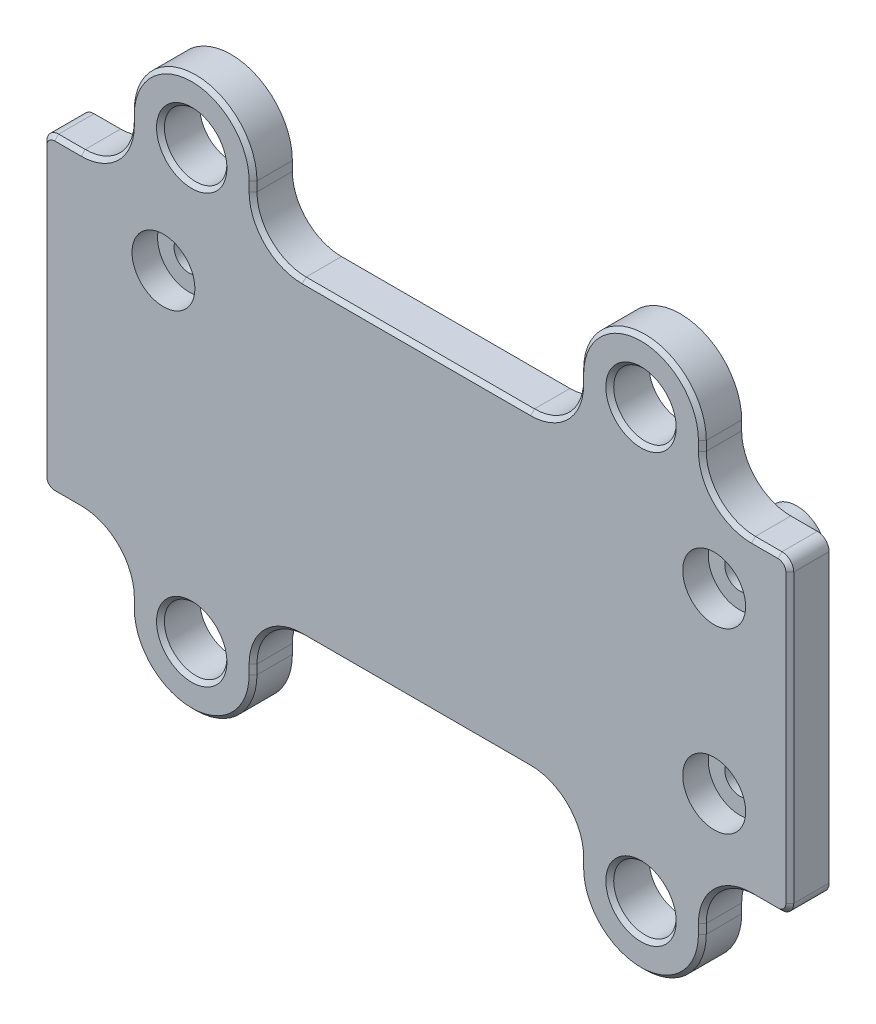
from build123d import *
from build123d.topology import SkipClean

# Parameters (mm, degrees)
SKETCH1_W               = 48.26
SKETCH1_H               = 35.56
BOSS_EXTRUDE1_DEPTH     = 4.445
SKETCH2_OUTSIDE_W       = 62.282
SKETCH2_OUTSIDE_H       = 49.582
CUT_EXTRUDE2_DEPTH      = 61.110724709
SKETCH3_R               = 2.0193
CUT_EXTRUDE3_DEPTH      = 61.110724709
CHAMFER1_SIZE           = 0.254
SKETCH4_OUTSIDE_W       = 62.282
SKETCH4_OUTSIDE_H       = 49.582
SKETCH4_OUTSIDE_W_2     = 12.446
SKETCH4_OUTSIDE_H_2     = 1.524
CUT_EXTRUDE4_DEPTH      = 1.905
SKETCH16_W              = 12.446
SKETCH16_H              = 1.524
BOSS_EXTRUDE12_DEPTH    = 1.27
CUT_EXTRUDE5_DEPTH      = 1.016
BOSS_EXTRUDE2_DEPTH     = 1.016
CUT_EXTRUDE6_DEPTH      = 48.4925664
CUT_EXTRUDE6_DEPTH_BACK = 48.4925664
F_3DSKETCH1_R           = 0.9652
F_3DSKETCH1_R_2         = 0.5715
SKETCH7_R               = 0.5715
CUT_EXTRUDE7_DEPTH      = 2.54
SKETCH9_W               = 4.902032443
SKETCH9_H               = 4.572
SKETCH9_R               = 0.9652
SKETCH9_W_2             = 6.35
SKETCH9_H_2             = 4.497155915
SKETCH9_H_3             = 4.013032443
BOSS_EXTRUDE8_DEPTH     = 1.016
SKETCH8_R               = 2.032
CUT_EXTRUDE8_DEPTH      = 1.651
CHAMFER4_SIZE           = 0.127
FILLET1_R               = 3.175
SKETCH11_R              = 1.9558
SKETCH11_R_2            = 0.9652
BOSS_EXTRUDE9_DEPTH     = 2.794
FILLET2_R               = 2.54
FILLET3_R               = 0.7874
BOSS_EXTRUDE10_DEPTH    = 1.016
BOSS_EXTRUDE11_DEPTH    = 1.016
FILLET4_START           = 1.905
FILLET4_DEPTH           = 2.095
CHAMFER6_DEPTH          = 1.905
DRAFT1_ANGLE            = 3


with BuildPart() as part:
    # Sketch1 → Boss-Extrude1 (new body)
    with BuildSketch(Plane.XY):
        with Locations((24.13, 17.78)):
            Rectangle(SKETCH1_W, SKETCH1_H)
    extrude(amount=BOSS_EXTRUDE1_DEPTH)

    # Sketch2 outside → Cut-Extrude2 (cut, through all)
    with BuildSketch(Plane.XY.offset(4.445)):
        with Locations((24.13, 17.78)):
            Rectangle(SKETCH2_OUTSIDE_W, SKETCH2_OUTSIDE_H)
        with BuildLine():
            Line((0.762, 7.747), (2.4765, 7.747))
            ThreePointArc((2.4765, 7.747), (4.72156403, 6.81706403), (5.6515, 4.572))
            Line((5.6515, 4.572), (5.6515, 3.9624))
            ThreePointArc((5.6515, 3.9624), (9.6139, 0), (13.5763, 3.9624))
            Line((13.5763, 3.9624), (13.5763, 4.572))
            ThreePointArc((13.5763, 4.572), (14.50623597, 6.81706403), (16.7513, 7.747))
            Line((16.7513, 7.747), (31.5087, 7.747))
            ThreePointArc((31.5087, 7.747), (33.75376403, 6.81706403), (34.6837, 4.572))
            Line((34.6837, 4.572), (34.6837, 3.9624))
            ThreePointArc((34.6837, 3.9624), (38.6461, 0), (42.6085, 3.9624))
            Line((42.6085, 3.9624), (42.6085, 4.572))
            ThreePointArc((42.6085, 4.572), (43.53843597, 6.81706403), (45.7835, 7.747))
            Line((45.7835, 7.747), (47.498, 7.747))
            ThreePointArc((47.498, 7.747), (48.036815367, 7.970184633), (48.26, 8.509))
            Line((48.26, 8.509), (48.26, 27.051))
            ThreePointArc((48.26, 27.051), (48.036815367, 27.589815367), (47.498, 27.813))
            Line((47.498, 27.813), (45.7835, 27.813))
            ThreePointArc((45.7835, 27.813), (43.53843597, 28.74293597), (42.6085, 30.988))
            Line((42.6085, 30.988), (42.6085, 31.5976))
            ThreePointArc((42.6085, 31.5976), (38.6461, 35.56), (34.6837, 31.5976))
            Line((34.6837, 31.5976), (34.6837, 30.988))
            ThreePointArc((34.6837, 30.988), (33.75376403, 28.74293597), (31.5087, 27.813))
            Line((31.5087, 27.813), (16.7513, 27.813))
            ThreePointArc((16.7513, 27.813), (14.50623597, 28.74293597), (13.5763, 30.988))
            Line((13.5763, 30.988), (13.5763, 31.5976))
            ThreePointArc((13.5763, 31.5976), (9.6139, 35.56), (5.6515, 31.5976))
            Line((5.6515, 31.5976), (5.6515, 30.988))
            ThreePointArc((5.6515, 30.988), (4.72156403, 28.74293597), (2.4765, 27.813))
            Line((2.4765, 27.813), (0.762, 27.813))
            ThreePointArc((0.762, 27.813), (0.223184633, 27.589815367), (0, 27.051))
            Line((0, 27.051), (0, 8.509))
            ThreePointArc((0, 8.509), (0.223184633, 7.970184633), (0.762, 7.747))
        make_face(mode=Mode.SUBTRACT)
    extrude(amount=-CUT_EXTRUDE2_DEPTH, mode=Mode.SUBTRACT)

    # Sketch3 → Cut-Extrude3 (cut, through all)
    with BuildSketch(Plane.XY.offset(4.445)):
        with Locations((9.6139, 31.5976)):
            Circle(SKETCH3_R)
        with Locations((38.6461, 31.5976)):
            Circle(SKETCH3_R)
        with Locations((38.6461, 3.9624)):
            Circle(SKETCH3_R)
        with Locations((9.6139, 3.9624)):
            Circle(SKETCH3_R)
    extrude(amount=-CUT_EXTRUDE3_DEPTH, mode=Mode.SUBTRACT)

    # Chamfer1
    chamfer1_edges = [part.edges().sort_by_distance(p)[0] for p in [
        (7.5946, 31.5976, 4.445),
        (36.6268, 31.5976, 4.445),
        (36.6268, 3.9624, 4.445),
        (7.5946, 3.9624, 4.445),
        (0, 17.78, 4.445),
        (48.26, 17.78, 4.445),
        (9.6139, 35.56, 4.445),
        (38.6461, 35.56, 4.445),
        (38.6461, 0, 4.445),
        (9.6139, 0, 4.445),
        (4.72156403, 6.81706403, 4.445),
        (1.61925, 7.747, 4.445),
        (0.223184633, 7.970184633, 4.445),
        (0.223184633, 27.589815367, 4.445),
        (1.61925, 27.813, 4.445),
        (4.72156403, 28.74293597, 4.445),
        (5.6515, 31.2928, 4.445),
        (13.5763, 31.2928, 4.445),
        (14.50623597, 28.74293597, 4.445),
        (24.13, 27.813, 4.445),
        (33.75376403, 28.74293597, 4.445),
        (34.6837, 31.2928, 4.445),
        (42.6085, 31.2928, 4.445),
        (43.53843597, 28.74293597, 4.445),
        (46.64075, 27.813, 4.445),
        (48.036815367, 27.589815367, 4.445),
        (48.036815367, 7.970184633, 4.445),
        (46.64075, 7.747, 4.445),
        (43.53843597, 6.81706403, 4.445),
        (42.6085, 4.2672, 4.445),
        (34.6837, 4.2672, 4.445),
        (33.75376403, 6.81706403, 4.445),
        (24.13, 7.747, 4.445),
        (14.50623597, 6.81706403, 4.445),
        (13.5763, 4.2672, 4.445),
        (5.6515, 4.2672, 4.445),
    ]]
    chamfer(chamfer1_edges, length=CHAMFER1_SIZE)

    # Sketch4 outside → Cut-Extrude4 (cut)
    with BuildSketch(Plane(origin=(0, 0, 0), x_dir=(-1, 0, 0), z_dir=(0, 0, -1))):
        with Locations((-24.13, 17.78)):
            Rectangle(SKETCH4_OUTSIDE_W, SKETCH4_OUTSIDE_H)
        with Locations((-22.225, 8.509)):
            Rectangle(SKETCH4_OUTSIDE_W_2, SKETCH4_OUTSIDE_H_2, mode=Mode.SUBTRACT)
    extrude(amount=-CUT_EXTRUDE4_DEPTH, mode=Mode.SUBTRACT)

    # Sketch16 → Boss-Extrude12 (add)
    with BuildSketch(Plane(origin=(0, 0, 0), x_dir=(-1, 0, 0), z_dir=(0, 0, -1))):
        with Locations((-22.225, 8.509)):
            Rectangle(SKETCH16_W, SKETCH16_H)
    extrude(amount=BOSS_EXTRUDE12_DEPTH)

    # Sketch5 → Cut-Extrude5 (cut)
    with BuildSketch(Plane(origin=(0, 0, 1.905), x_dir=(-1, 0, 0), z_dir=(0, 0, -1))):
        with BuildLine():
            Line((-44.6278, 10.414), (-3.6322, 10.414))
            ThreePointArc((-3.6322, 10.414), (-3.039503096, 10.659503096), (-2.794, 11.2522))
            Line((-2.794, 11.2522), (-2.794, 24.3078))
            ThreePointArc((-2.794, 24.3078), (-3.039503096, 24.900496904), (-3.6322, 25.146))
            Line((-3.6322, 25.146), (-44.6278, 25.146))
            ThreePointArc((-44.6278, 25.146), (-45.220496904, 24.900496904), (-45.466, 24.3078))
            Line((-45.466, 24.3078), (-45.466, 11.2522))
            ThreePointArc((-45.466, 11.2522), (-45.220496904, 10.659503096), (-44.6278, 10.414))
        make_face()
    extrude(amount=-CUT_EXTRUDE5_DEPTH, mode=Mode.SUBTRACT)

    # Sketch6 → Boss-Extrude2 (add)
    with BuildSketch(Plane(origin=(0, 0, 1.905), x_dir=(-1, 0, 0), z_dir=(0, 0, -1))):
        with BuildLine():
            Line((-2.54, 9.2075), (-6.553032443, 9.2075))
            Line((-6.553032443, 9.2075), (-6.807032443, 9.4615))
            Line((-6.807032443, 9.4615), (-6.807032443, 10.16))
            Line((-6.807032443, 10.16), (-6.553032443, 10.414))
            Line((-6.553032443, 10.414), (-3.632032443, 10.414))
            ThreePointArc((-3.632032443, 10.414), (-3.03945402, 10.65945402), (-2.794, 11.252032443))
            Line((-2.794, 11.252032443), (-2.794, 14.173032443))
            Line((-2.794, 14.173032443), (-2.54, 14.427032443))
            Line((-2.54, 14.427032443), (-1.905, 14.427032443))
            Line((-1.905, 14.427032443), (-1.651, 14.173032443))
            Line((-1.651, 14.173032443), (-1.651, 10.0965))
            ThreePointArc((-1.651, 10.0965), (-1.911382072, 9.467882072), (-2.54, 9.2075))
        make_face()
        with BuildLine():
            Line((-2.54, 26.3525), (-6.8072, 26.3525))
            Line((-6.8072, 26.3525), (-6.8072, 26.2255))
            Line((-6.8072, 26.2255), (-6.8072, 25.273))
            Line((-6.8072, 25.273), (-6.8072, 25.146))
            Line((-6.8072, 25.146), (-3.632032443, 25.146))
            ThreePointArc((-3.632032443, 25.146), (-3.03945402, 24.90054598), (-2.794, 24.307967557))
            Line((-2.794, 24.307967557), (-2.794, 21.386967557))
            Line((-2.794, 21.386967557), (-2.54, 21.132967557))
            Line((-2.54, 21.132967557), (-1.905, 21.132967557))
            Line((-1.905, 21.132967557), (-1.651, 21.386967557))
            Line((-1.651, 21.386967557), (-1.651, 25.4635))
            ThreePointArc((-1.651, 25.4635), (-1.911382072, 26.092117928), (-2.54, 26.3525))
        make_face()
        with BuildLine():
            Line((-46.609, 10.0965), (-46.609, 14.301381018))
            Line((-46.609, 14.301381018), (-46.609, 14.427032443))
            Line((-46.609, 14.427032443), (-45.593, 14.427032443))
            Line((-45.593, 14.427032443), (-45.466, 14.427032443))
            Line((-45.466, 14.427032443), (-45.466, 11.252032443))
            ThreePointArc((-45.466, 11.252032443), (-45.22054598, 10.65945402), (-44.627967557, 10.414))
            Line((-44.627967557, 10.414), (-40.563967557, 10.414))
            Line((-40.563967557, 10.414), (-40.563967557, 10.287))
            Line((-40.563967557, 10.287), (-40.563967557, 9.3345))
            Line((-40.563967557, 9.3345), (-40.563967557, 9.2075))
            Line((-40.563967557, 9.2075), (-45.72, 9.2075))
            ThreePointArc((-45.72, 9.2075), (-46.348617928, 9.467882072), (-46.609, 10.0965))
        make_face()
        with BuildLine():
            Line((-45.593, 21.132967557), (-46.609, 21.132967557))
            Line((-46.609, 21.132967557), (-46.609, 21.2598))
            Line((-46.609, 21.2598), (-46.609, 25.4635))
            ThreePointArc((-46.609, 25.4635), (-46.348617928, 26.092117928), (-45.72, 26.3525))
            Line((-45.72, 26.3525), (-40.563967557, 26.3525))
            Line((-40.563967557, 26.3525), (-40.563967557, 26.2255))
            Line((-40.563967557, 26.2255), (-40.563967557, 25.273))
            Line((-40.563967557, 25.273), (-40.563967557, 25.146))
            Line((-40.563967557, 25.146), (-44.627967557, 25.146))
            ThreePointArc((-44.627967557, 25.146), (-45.22054598, 24.90054598), (-45.466, 24.307967557))
            Line((-45.466, 24.307967557), (-45.466, 21.132967557))
            Line((-45.466, 21.132967557), (-45.593, 21.132967557))
        make_face()
        Polygon((-26.5176, 26.0985), (-26.2636, 26.3525), (-21.9964, 26.3525), (-21.7424, 26.0985), (-21.7424, 25.4), (-21.9964, 25.146), (-26.2636, 25.146), (-26.5176, 25.4), align=None)
    extrude(amount=BOSS_EXTRUDE2_DEPTH)

    # 3DSketch1 → Cut-Extrude6 (cut, two sides: drawn at the far end of the back side and taken through both)
    # profile 1 of 3: a face of its own
    with BuildSketch(Plane(origin=(7.786455915, 23.823844085, -2.6162), x_dir=(0.9516958120786183, -0.3070424747034511, 0), z_dir=(0, 0, 1)).offset(-CUT_EXTRUDE6_DEPTH_BACK)):
        with Locations(Location((33.866476151, 10.926229279, 0), (0, 0, 17.88108636))):
            Circle(F_3DSKETCH1_R)
        with Locations(Location((33.866476151, 10.926229279, 0), (0, 0, 17.88108636))):
            Circle(F_3DSKETCH1_R_2, mode=Mode.SUBTRACT)
    # profile 2 of 3: a face of its own
    with BuildSketch(Plane(origin=(7.786455915, 23.823844085, -2.6162), x_dir=(0.9516958120786183, -0.3070424747034511, 0), z_dir=(0, 0, 1)).offset(-CUT_EXTRUDE6_DEPTH_BACK)):
        with Locations(Location((37.391569395, 0, 0), (0, 0, 17.88108636))):
            Circle(F_3DSKETCH1_R)
        with Locations(Location((37.391569395, 0, 0), (0, 0, 17.88108636))):
            Circle(F_3DSKETCH1_R_2, mode=Mode.SUBTRACT)
    # profile 3 of 3: a face of its own
    with BuildSketch(Plane(origin=(7.786455915, 23.823844085, -2.6162), x_dir=(0.9516958120786183, -0.3070424747034511, 0), z_dir=(0, 0, 1)).offset(-CUT_EXTRUDE6_DEPTH_BACK)):
        with Locations(Location((0, 0, 0), (0, 0, 17.88108636))):
            Circle(F_3DSKETCH1_R)
        with Locations(Location((0, 0, 0), (0, 0, 17.88108636))):
            Circle(F_3DSKETCH1_R_2, mode=Mode.SUBTRACT)
    extrude(amount=CUT_EXTRUDE6_DEPTH + CUT_EXTRUDE6_DEPTH_BACK, mode=Mode.SUBTRACT)


with BuildPart() as cut_extrude6_piece_1:
    # of the separate pieces the step leaves, piece 1, a body of its own (cut_extrude6_pieces)
    add(part.part.solids().sort_by_distance((5.6515, 3.9624, 4.191))[0])

    # Sketch9 → Boss-Extrude8 (add)
    # profile 1 of 3: a face of its own
    with BuildSketch(Plane(origin=(0, 0, 2.921), x_dir=(-1, 0, 0), z_dir=(0, 0, -1))):
        with Locations((-43.014983779, 12.7)):
            Rectangle(SKETCH9_W, SKETCH9_H)
        with Locations(Location((-43.371855915, 12.343044085, 0), (0, 0, 180))):
            Circle(SKETCH9_R, mode=Mode.SUBTRACT)
    # profile 2 of 3: a face of its own
    with BuildSketch(Plane(origin=(0, 0, 2.921), x_dir=(-1, 0, 0), z_dir=(0, 0, -1))):
        with Locations((-7.786455915, 22.897422043)):
            Rectangle(SKETCH9_W_2, SKETCH9_H_2)
        with Locations(Location((-7.786455915, 23.823844085, 0), (0, 0, 180))):
            Circle(SKETCH9_R, mode=Mode.SUBTRACT)
    # profile 3 of 3: a face of its own
    with BuildSketch(Plane(origin=(0, 0, 2.921), x_dir=(-1, 0, 0), z_dir=(0, 0, -1))):
        with Locations((-43.014983779, 23.139483779)):
            Rectangle(SKETCH9_W, SKETCH9_H_3)
        with Locations(Location((-43.371855915, 23.823844085, 0), (0, 0, 180))):
            Circle(SKETCH9_R, mode=Mode.SUBTRACT)
    extrude(amount=BOSS_EXTRUDE8_DEPTH)

    # Sketch8 → Cut-Extrude8 (cut)
    with BuildSketch(Plane.XY.offset(4.445)):
        with Locations((7.786455915, 23.823844085)):
            Circle(SKETCH8_R)
        with Locations((43.371855915, 23.823844085)):
            Circle(SKETCH8_R)
        with Locations((43.371855915, 12.343044085)):
            Circle(SKETCH8_R)
    extrude(amount=-CUT_EXTRUDE8_DEPTH, mode=Mode.SUBTRACT)

    # Chamfer4
    chamfer4_edges = [cut_extrude6_piece_1.edges().sort_by_distance(p)[0] for p in [
        (24.13, 26.3525, 0.889),
        (26.3906, 26.2255, 0.889),
        (26.5176, 25.74925, 0.889),
        (26.3906, 25.273, 0.889),
        (24.13, 25.146, 0.889),
        (21.8694, 25.273, 0.889),
        (21.7424, 25.74925, 0.889),
        (21.8694, 26.2255, 0.889),
    ]]
    chamfer(chamfer4_edges, length=CHAMFER4_SIZE)

    # Fillet1
    fillet1_edges = [cut_extrude6_piece_1.edges().sort_by_distance(p)[0] for p in [
        (10.961455915, 20.648844085, 2.413),
        (4.611455915, 20.648844085, 2.413),
    ]]
    fillet(fillet1_edges, radius=FILLET1_R - 0.0001)  # a hair under: the kernel refuses the full size

    # Sketch11 → Boss-Extrude9 (add)
    # profile 1 of 3: a face of its own
    with BuildSketch(Plane(origin=(0, 0, 1.905), x_dir=(-1, 0, 0), z_dir=(0, 0, -1))):
        with Locations(Location((-43.371855915, 23.823844085, 0), (0, 0, 138.510032486))):
            Circle(SKETCH11_R)
        with Locations(Location((-43.371855915, 23.823844085, 0), (0, 0, 180))):
            Circle(SKETCH11_R_2, mode=Mode.SUBTRACT)
    # profile 2 of 3: a face of its own
    with BuildSketch(Plane(origin=(0, 0, 1.905), x_dir=(-1, 0, 0), z_dir=(0, 0, -1))):
        with Locations(Location((-43.371855915, 12.343044085, 0), (0, 0, 260.511847353))):
            Circle(SKETCH11_R)
        with Locations(Location((-43.371855915, 12.343044085, 0), (0, 0, 180))):
            Circle(SKETCH11_R_2, mode=Mode.SUBTRACT)
    # profile 3 of 3: a face of its own
    with BuildSketch(Plane(origin=(0, 0, 1.905), x_dir=(-1, 0, 0), z_dir=(0, 0, -1))):
        with Locations(Location((-7.786455915, 23.823844085, 0), (0, 0, 59.954122435))):
            Circle(SKETCH11_R)
        with Locations(Location((-7.786455915, 23.823844085, 0), (0, 0, 180))):
            Circle(SKETCH11_R_2, mode=Mode.SUBTRACT)
    extrude(amount=BOSS_EXTRUDE9_DEPTH)

    # Fillet2
    fillet2_edges = [cut_extrude6_piece_1.edges().sort_by_distance(p)[0] for p in [
        (40.563967557, 21.132967557, 2.413),
        (40.563967557, 14.986, 2.413),
    ]]
    fillet(fillet2_edges, radius=FILLET2_R)

    # Fillet3
    # the kernel refuses this fillet: 0.7874 mm, written as the material it adds along each edge
    with BuildSketch(Plane(origin=(41.930655936, 25.146, 0.889), x_dir=(-1, 0, 0), z_dir=(0, 0, 1))) as fillet3_piece_1:
        with BuildLine():
            CenterArc((1.249372889, 0.7874), FILLET3_R, 168.758855809, 101.241144191)
            Line((0.477078825, 0.940894753), (0.461632944, 0.943964648))
            ThreePointArc((0.461632944, 0.943964648), (0.289129693, 0.444795675), (-0.011604467, 0.010645931))
            Line((-0.011604467, 0.010645931), (0, -0.015748))
            Line((0, -0.015748), (1.249372889, -0.015748))
            Line((1.249372889, -0.015748), (1.249372889, 0))
        make_face()
    extrude(amount=1.016)
    with BuildSketch(Plane(origin=(43.049454679, 10.414, 0.889), x_dir=(-1, 0, 0), z_dir=(0, 0, 1))) as fillet3_piece_2:
        with BuildLine():
            CenterArc((2.17195139, -0.7874), FILLET3_R, 90, 114.593168844)
            Line((1.455979803, -1.115094136), (1.441660371, -1.121648018))
            ThreePointArc((1.441660371, -1.121648018), (0.857216562, -0.388815656), (-0.002595958, -0.015532563))
            Line((-0.002595958, -0.015532563), (0, 0.015748))
            Line((0, 0.015748), (2.17195139, 0.015748))
            Line((2.17195139, 0.015748), (2.17195139, 0))
        make_face()
    extrude(amount=1.016)
    with BuildSketch(Plane(origin=(6.345255936, 25.146, 0.889), x_dir=(-0.4522354245640404, -0.8918986045338236, 0), z_dir=(0, 0, 1))) as fillet3_piece_3:
        with BuildLine():
            CenterArc((1.26729164, -0.758223763), FILLET3_R, 105.646052984, 101.241144191)
            Line((0.565010679, -1.114313936), (0.550965059, -1.121435739))
            Line((0.550965059, -1.121435739), (-0.014045619, -0.007121803))
            Line((-0.014045619, -0.007121803), (0.00424714, 0.015164475))
            ThreePointArc((0.00424714, 0.015164475), (0.527467331, -0.056722009), (1.050687523, 0.015164475))
            Line((1.050687523, 0.015164475), (1.054934662, 0))
        make_face()
    extrude(amount=1.016)
    with BuildSketch(Plane(origin=(6.8072, 25.516833008, 1.905), x_dir=(5.384336008781321e-12, 1.0, 0), z_dir=(0, 0, -1))) as fillet3_piece_4:
        with BuildLine():
            CenterArc((1.041437811, 0.760037585), FILLET3_R, 175.416414294, 79.434623289)
            Line((0.256556063, 0.822961364), (0.240858428, 0.82421984))
            ThreePointArc((0.240858428, 0.82421984), (0.159148279, 0.401856963), (-0.013631859, 0.007884918))
            Line((-0.013631859, 0.007884918), (0, -0.015748))
            ThreePointArc((0, -0.015748), (0.417833496, -0.015748), (0.831551575, -0.015200752))
            Line((0.831551575, -0.015200752), (0.835666992, 0))
        make_face()
    extrude(amount=1.016)

    # Sketch14 → Boss-Extrude10 (add)
    with BuildSketch(Plane(origin=(0, 0, 1.905), x_dir=(-1, 0, 0), z_dir=(0, 0, -1))):
        with BuildLine():
            Line((-45.466, 21.645595789), (-45.466, 24.307967557))
            ThreePointArc((-45.466, 24.307967557), (-45.290305275, 24.821394399), (-44.836890412, 25.119539868))
            ThreePointArc((-44.836890412, 25.119539868), (-44.654501698, 25.300317395), (-44.45, 25.455640326))
            Line((-44.45, 25.455640326), (-44.45, 22.192047845))
            ThreePointArc((-44.45, 22.192047845), (-45.121284698, 22.222411585), (-45.466, 21.645595789))
        make_face()
    extrude(amount=BOSS_EXTRUDE10_DEPTH)

    # Sketch15 → Boss-Extrude11 (add)
    with BuildSketch(Plane(origin=(0, 0, 1.905), x_dir=(-1, 0, 0), z_dir=(0, 0, -1))):
        with BuildLine():
            Line((-45.466, 11.252032443), (-45.466, 14.427032443))
            ThreePointArc((-45.466, 14.427032443), (-44.993320854, 13.978588304), (-44.344640805, 14.039759499))
            ThreePointArc((-44.344640805, 14.039759499), (-44.271144143, 14.079832594), (-44.196, 14.116723923))
            Line((-44.196, 14.116723923), (-44.45, 13.251247845))
            Line((-44.45, 13.251247845), (-44.45, 10.711247845))
            ThreePointArc((-44.45, 10.711247845), (-44.087726622, 10.522966403), (-43.69425715, 10.414))
            Line((-43.69425715, 10.414), (-44.627967557, 10.414))
            ThreePointArc((-44.627967557, 10.414), (-45.22054598, 10.65945402), (-45.466, 11.252032443))
        make_face()
    extrude(amount=BOSS_EXTRUDE11_DEPTH)

    # Fillet4: read off the stored shape, not the designer's step
    # Fillet4 outline → Fillet4 (add)
    with BuildSketch(Plane.XY.offset(FILLET4_START)):
        with BuildLine():
            Line((10.961455915, 25.146), (10.961455915, 24.3586))
            ThreePointArc((10.961455915, 24.3586), (11.192080035, 24.91537588), (11.748855915, 25.146))
            Line((11.748855915, 25.146), (10.961455915, 25.146))
        make_face()
        with BuildLine():
            Line((40.563967557, 25.146), (39.776567557, 25.146))
            ThreePointArc((39.776567557, 25.146), (40.333343437, 24.91537588), (40.563967557, 24.3586))
            Line((40.563967557, 24.3586), (40.563967557, 25.146))
        make_face()
        with BuildLine():
            Line((4.611455915, 25.146), (3.824055915, 25.146))
            ThreePointArc((3.824055915, 25.146), (4.380831794, 24.915375879), (4.611455915, 24.3586))
            Line((4.611455915, 24.3586), (4.611455915, 25.146))
        make_face()
        with BuildLine():
            Line((40.563967557, 10.414), (40.563967557, 11.2014))
            ThreePointArc((40.563967557, 11.2014), (40.333343437, 10.64462412), (39.776567557, 10.414))
            Line((39.776567557, 10.414), (40.563967557, 10.414))
        make_face()
        with BuildLine():
            Line((45.466, 14.986), (45.466, 15.7734))
            ThreePointArc((45.466, 15.7734), (45.23537588, 15.21662412), (44.6786, 14.986))
            Line((44.6786, 14.986), (45.466, 14.986))
        make_face()
        with BuildLine():
            ThreePointArc((44.6786, 21.132967557), (45.235375879, 20.902343436), (45.466, 20.345567557))
            Line((45.466, 20.345567557), (45.466, 21.132967557))
            Line((45.466, 21.132967557), (44.6786, 21.132967557))
        make_face()
    extrude(amount=FILLET4_DEPTH)

    # Chamfer6: read off the stored shape, not the designer's step
    # Chamfer6 outline → Chamfer6 (cut)
    with SkipClean():  # the faces are left unmerged after this step: merging them gives an invalid solid
        with BuildSketch(Plane.XY):
            with BuildLine():
                Line((6.619572376, 26.3525), (6.917378711, 26.113656149))
                ThreePointArc((6.917378711, 26.113656149), (6.852245555, 26.228444868), (6.8072, 26.3525))
                Line((6.8072, 26.3525), (6.619572376, 26.3525))
            make_face()
            Polygon((45.466, 21.132967557), (45.72, 21.132967557), (45.466, 21.386967557), align=None)
            Polygon((46.609, 21.386967557), (46.355, 21.132967557), (46.609, 21.132967557), align=None)
            Polygon((40.563967557, 26.3525), (40.563967557, 26.0985), (40.817967557, 26.3525), align=None)
            with BuildLine():
                Line((40.784629872, 25.139188364), (40.563967557, 25.390991062))
                Line((40.563967557, 25.390991062), (40.563967557, 25.146))
                Line((40.563967557, 25.146), (40.681283048, 25.146))
                ThreePointArc((40.681283048, 25.146), (40.733068578, 25.144295246), (40.784629872, 25.139188364))
            make_face()
            Polygon((46.609, 14.427032443), (46.355, 14.427032443), (46.609, 14.173032443), align=None)
            with BuildLine():
                Line((45.279998761, 14.15331758), (45.926936637, 14.427032443))
                Line((45.926936637, 14.427032443), (45.466, 14.427032443))
                ThreePointArc((45.466, 14.427032443), (45.387541521, 14.28029299), (45.279998761, 14.15331758))
            make_face()
            Polygon((40.563967557, 10.414), (40.563967557, 10.16), (40.817967557, 10.414), align=None)
            Polygon((40.817967557, 9.2075), (40.563967557, 9.4615), (40.563967557, 9.2075), align=None)
        extrude(amount=CHAMFER6_DEPTH, mode=Mode.SUBTRACT)

    # Draft1
    draft1_faces = [cut_extrude6_piece_1.faces().sort_by_distance(p)[0] for p in [
        (16.002, 8.509, 0.3175),
        (28.448, 8.509, 0.3175),
    ]]
    draft(draft1_faces, Plane(origin=(0, 0, 1.905), x_dir=(-1, 0, 0), z_dir=(0, 0, -1)), DRAFT1_ANGLE)


with BuildPart() as cut_extrude6_piece_2:
    # of the separate pieces the step leaves, piece 2, a body of its own (cut_extrude6_pieces)
    add(part.part.solids().sort_by_distance((8.357955915, 23.823844085, 4.445))[0])


with BuildPart() as cut_extrude6_piece_3:
    # of the separate pieces the step leaves, piece 3, a body of its own (cut_extrude6_pieces)
    add(part.part.solids().sort_by_distance((43.943355915, 12.343044085, 4.445))[0])


with BuildPart() as cut_extrude6_piece_4:
    # of the separate pieces the step leaves, piece 4, a body of its own (cut_extrude6_pieces)
    add(part.part.solids().sort_by_distance((43.943355915, 23.823844085, 4.445))[0])


with BuildPart() as cut_extrude7_tool:
    # Sketch7 → Cut-Extrude7 (new body)
    with BuildSketch(Plane.XY.offset(4.445)):
        with Locations((7.786455915, 23.823844085)):
            Circle(SKETCH7_R)
        with Locations((43.371855915, 23.823844085)):
            Circle(SKETCH7_R)
        with Locations((43.371855915, 12.343044085)):
            Circle(SKETCH7_R)
    extrude(amount=-CUT_EXTRUDE7_DEPTH)


with BuildPart() as cut_extrude6_piece_2_1:
    add(cut_extrude6_piece_2.part)

    # Cut-Extrude7: cut by cut_extrude7_tool
    add(cut_extrude7_tool.part, mode=Mode.SUBTRACT)


with BuildPart() as cut_extrude6_piece_3_1:
    add(cut_extrude6_piece_3.part)

    # Cut-Extrude7: cut by cut_extrude7_tool
    add(cut_extrude7_tool.part, mode=Mode.SUBTRACT)


with BuildPart() as cut_extrude6_piece_4_1:
    add(cut_extrude6_piece_4.part)

    # Cut-Extrude7: cut by cut_extrude7_tool
    add(cut_extrude7_tool.part, mode=Mode.SUBTRACT)


solid = cut_extrude6_piece_1.part
